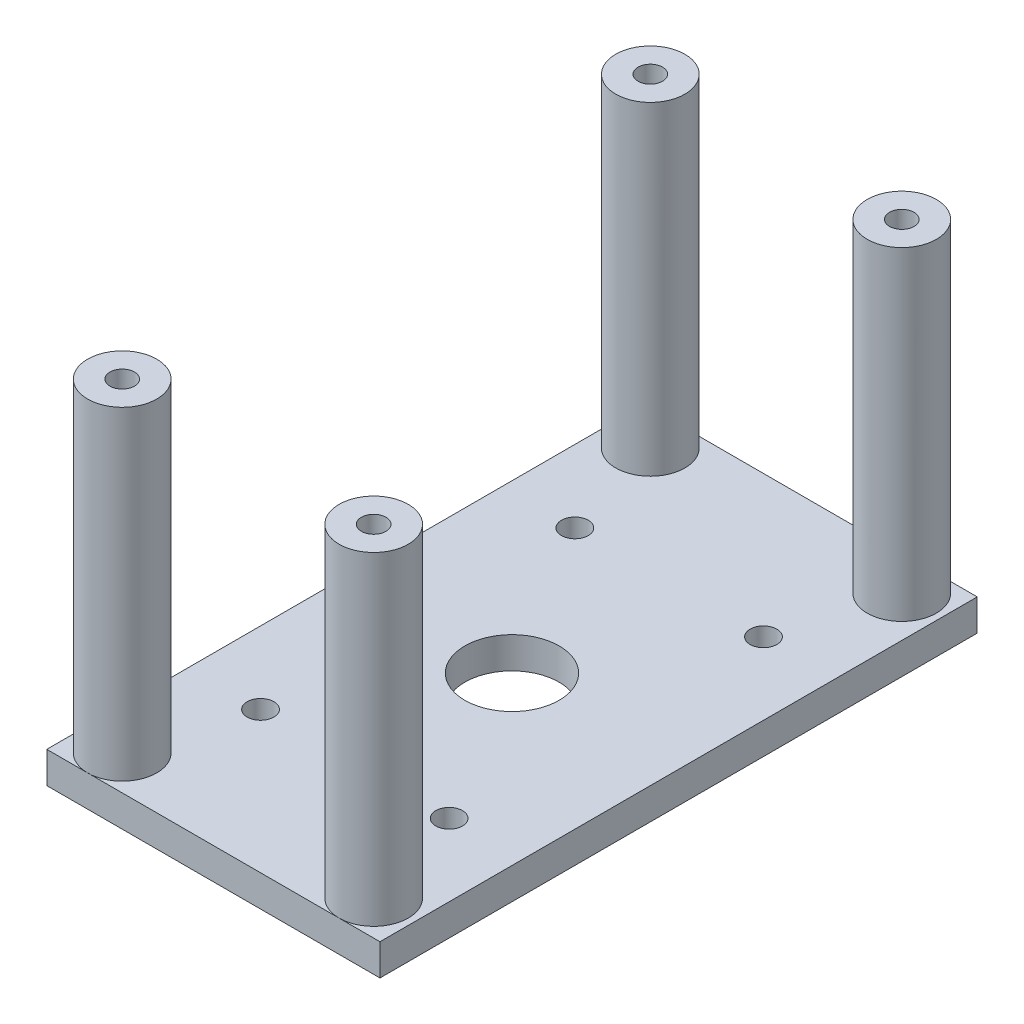
from build123d import *

# Parameters (mm, degrees)
SKETCH1_W           = 53
SKETCH1_H           = 95
BOSS_EXTRUDE1_DEPTH = 5
SKETCH2_R           = 5.5
SKETCH2_R_2         = 1.95
BOSS_EXTRUDE2_DEPTH = 51.5
SKETCH4_R           = 7.5
SKETCH4_R_2         = 2.125
CUT_EXTRUDE1_DEPTH  = 121.358838479


with BuildPart() as part:
    # Sketch1 → Boss-Extrude1 (new body)
    with BuildSketch(Plane(origin=(0, 0, 0), x_dir=(1, 0, 0), z_dir=(0, 1, 0))):
        with Locations((26.5, 47.5)):
            Rectangle(SKETCH1_W, SKETCH1_H)
    extrude(amount=BOSS_EXTRUDE1_DEPTH)

    # Sketch2 → Boss-Extrude2 (add)
    # profile 1 of 4: a face of its own
    with BuildSketch(Plane(origin=(0, 5, 0), x_dir=(1, 0, 0), z_dir=(0, 1, 0))):
        with Locations((46.5, 89.5)):
            Circle(SKETCH2_R)
        with Locations((46.5, 89.5)):
            Circle(SKETCH2_R_2, mode=Mode.SUBTRACT)
    # profile 2 of 4: a face of its own
    with BuildSketch(Plane(origin=(0, 5, 0), x_dir=(1, 0, 0), z_dir=(0, 1, 0))):
        with Locations((6.5, 89.5)):
            Circle(SKETCH2_R)
        with Locations((6.5, 89.5)):
            Circle(SKETCH2_R_2, mode=Mode.SUBTRACT)
    # profile 3 of 4: a face of its own
    with BuildSketch(Plane(origin=(0, 5, 0), x_dir=(1, 0, 0), z_dir=(0, 1, 0))):
        with Locations((6.5, 5.5)):
            Circle(SKETCH2_R)
        with Locations((6.5, 5.5)):
            Circle(SKETCH2_R_2, mode=Mode.SUBTRACT)
    # profile 4 of 4: a face of its own
    with BuildSketch(Plane(origin=(0, 5, 0), x_dir=(1, 0, 0), z_dir=(0, 1, 0))):
        with Locations((46.5, 5.5)):
            Circle(SKETCH2_R)
        with Locations((46.5, 5.5)):
            Circle(SKETCH2_R_2, mode=Mode.SUBTRACT)
    extrude(amount=BOSS_EXTRUDE2_DEPTH)

    # Sketch4 → Cut-Extrude1 (cut, through all)
    with BuildSketch(Plane(origin=(0, 5, 0), x_dir=(1, 0, 0), z_dir=(0, 1, 0))):
        with Locations((26.5, 47.5)):
            Circle(SKETCH4_R)
        with Locations((11.5, 72.5)):
            Circle(SKETCH4_R_2)
        with Locations((41.5, 72.5)):
            Circle(SKETCH4_R_2)
        with Locations((11.5, 22.5)):
            Circle(SKETCH4_R_2)
        with Locations((41.5, 22.5)):
            Circle(SKETCH4_R_2)
    extrude(amount=-CUT_EXTRUDE1_DEPTH, mode=Mode.SUBTRACT)


solid = part.part
